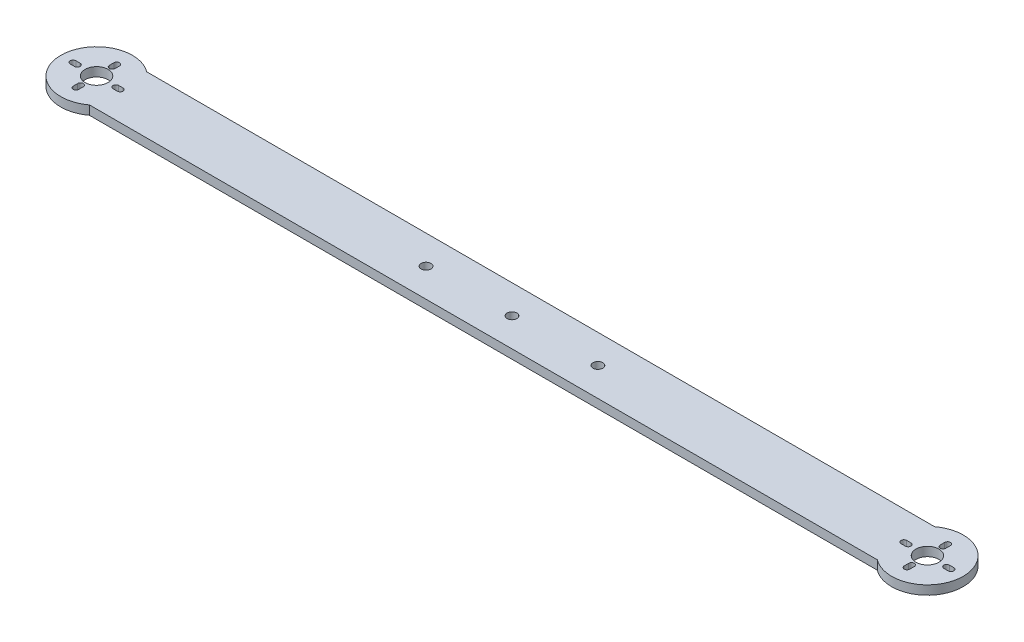
from build123d import *

# Parameters (mm, degrees)
BOSS_EXTRUDE1_DEPTH = 4
SKETCH2_R           = 5.08
CUT_EXTRUDE1_DEPTH  = 201.6938371
SKETCH3_R           = 2.159
CUT_EXTRUDE2_DEPTH  = 201.6938371


with BuildPart() as part:
    # Sketch1 → Boss-Extrude1 (new body)
    with BuildSketch(Plane(origin=(0, 0, 0), x_dir=(1, 0, 0), z_dir=(0, 1, 0))):
        with BuildLine():
            Line((-174.625, 12.7), (174.625, 12.7))
            ThreePointArc((174.625, 12.7), (200.025, 0), (174.625, -12.7))
            Line((174.625, -12.7), (-174.625, -12.7))
            ThreePointArc((-174.625, -12.7), (-200.025, 0), (-174.625, 12.7))
        make_face()
    extrude(amount=BOSS_EXTRUDE1_DEPTH)

    # Sketch2 → Cut-Extrude1 (cut, through all)
    with BuildSketch(Plane(origin=(0, 4, 0), x_dir=(1, 0, 0), z_dir=(0, 1, 0))):
        with Locations((184.15, 0)):
            Circle(SKETCH2_R)
        with Locations((-184.15, 0)):
            Circle(SKETCH2_R)
        with BuildLine():
            Line((173.691383345, 1.25), (175.608616655, 1.25))
            ThreePointArc((175.608616655, 1.25), (176.858616655, 0), (175.608616655, -1.25))
            Line((175.608616655, -1.25), (173.691383345, -1.25))
            ThreePointArc((173.691383345, -1.25), (172.441383345, 0), (173.691383345, 1.25))
        make_face()
        with BuildLine():
            Line((194.608616655, 1.25), (192.691383345, 1.25))
            ThreePointArc((192.691383345, 1.25), (191.441383345, 0), (192.691383345, -1.25))
            Line((192.691383345, -1.25), (194.608616655, -1.25))
            ThreePointArc((194.608616655, -1.25), (195.858616655, 0), (194.608616655, 1.25))
        make_face()
        with BuildLine():
            Line((185.4, 8.920928665), (185.4, 6.921035691))
            ThreePointArc((185.4, 6.921035691), (184.15, 5.671035691), (182.9, 6.921035691))
            Line((182.9, 6.921035691), (182.9, 8.920928665))
            ThreePointArc((182.9, 8.920928665), (184.15, 10.170928665), (185.4, 8.920928665))
        make_face()
        with BuildLine():
            Line((185.441381345, -9.078964309), (185.441381345, -7.078964309))
            ThreePointArc((185.441381345, -7.078964309), (184.191381345, -5.828964309), (182.941381345, -7.078964309))
            Line((182.941381345, -7.078964309), (182.941381345, -9.078964309))
            ThreePointArc((182.941381345, -9.078964309), (184.191381345, -10.328964309), (185.441381345, -9.078964309))
        make_face()
        with BuildLine():
            Line((-185.441381345, -9.078964309), (-185.441381345, -7.078964309))
            ThreePointArc((-185.441381345, -7.078964309), (-184.191381345, -5.828964309), (-182.941381345, -7.078964309))
            Line((-182.941381345, -7.078964309), (-182.941381345, -9.078964309))
            ThreePointArc((-182.941381345, -9.078964309), (-184.191381345, -10.328964309), (-185.441381345, -9.078964309))
        make_face()
        with BuildLine():
            Line((-185.4, 8.920928665), (-185.4, 6.921035691))
            ThreePointArc((-185.4, 6.921035691), (-184.15, 5.671035691), (-182.9, 6.921035691))
            Line((-182.9, 6.921035691), (-182.9, 8.920928665))
            ThreePointArc((-182.9, 8.920928665), (-184.15, 10.170928665), (-185.4, 8.920928665))
        make_face()
        with BuildLine():
            Line((-194.608616655, 1.25), (-192.691383345, 1.25))
            ThreePointArc((-192.691383345, 1.25), (-191.441383345, 0), (-192.691383345, -1.25))
            Line((-192.691383345, -1.25), (-194.608616655, -1.25))
            ThreePointArc((-194.608616655, -1.25), (-195.858616655, 0), (-194.608616655, 1.25))
        make_face()
        with BuildLine():
            Line((-173.691383345, 1.25), (-175.608616655, 1.25))
            ThreePointArc((-175.608616655, 1.25), (-176.858616655, 0), (-175.608616655, -1.25))
            Line((-175.608616655, -1.25), (-173.691383345, -1.25))
            ThreePointArc((-173.691383345, -1.25), (-172.441383345, 0), (-173.691383345, 1.25))
        make_face()
    extrude(amount=-CUT_EXTRUDE1_DEPTH, mode=Mode.SUBTRACT)

    # Sketch3 → Cut-Extrude2 (cut, through all)
    with BuildSketch(Plane(origin=(0, 4, 0), x_dir=(1, 0, 0), z_dir=(0, 1, 0))):
        Circle(SKETCH3_R)
        with Locations((38.1, 0)):
            Circle(SKETCH3_R)
        with Locations((-38.1, 0)):
            Circle(SKETCH3_R)
    extrude(amount=-CUT_EXTRUDE2_DEPTH, mode=Mode.SUBTRACT)


solid = part.part
